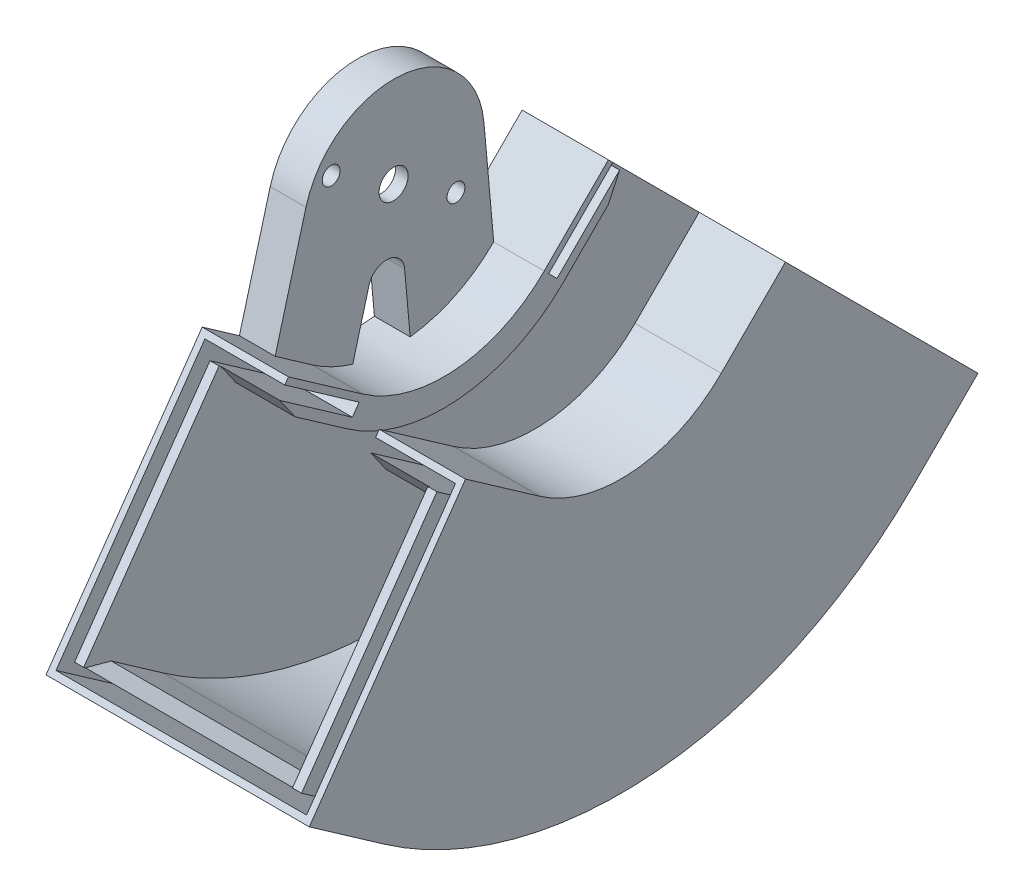
from build123d import *

# Parameters (mm, degrees)
BOSS_EXTRUDE2_DEPTH   = 58.42
BOSS_EXTRUDE2_2_DEPTH = 58.42
BOSS_EXTRUDE3_DEPTH   = 7.62
SKETCH6_W             = 73.66
SKETCH6_H             = 76.2
SKETCH6_W_2           = 70.104
SKETCH6_H_2           = 72.644
SKETCH6_W_3           = 63.5
SKETCH6_H_3           = 66.04
SKETCH6_W_4           = 58.42
SKETCH6_H_4           = 60.96
BOSS_EXTRUDE4_DEPTH   = 25.4
SKETCH7_W             = 73.66
SKETCH7_H             = 76.2
SKETCH7_W_2           = 70.104
SKETCH7_H_2           = 72.644
SKETCH7_W_3           = 63.5
SKETCH7_H_3           = 66.04
SKETCH7_W_4           = 58.42
SKETCH7_H_4           = 60.96
BOSS_EXTRUDE5_DEPTH   = 25.4
CHAMFER1_SIZE         = 2.773453185
CHAMFER1_SIZE_2       = 7.62
CUT_EXTRUDE3_REACH    = 158.41
SKETCH10_W            = 25.4
SKETCH10_H            = 177.72143494
SKETCH11_R            = 4.064
SKETCH11_R_2          = 2.5
BOSS_EXTRUDE6_DEPTH   = 10
SKETCH12_R            = 17
CUT_EXTRUDE4_DEPTH    = 6.5


with BuildPart() as part:
    # Sketch3 → Boss-Extrude2 (new body)
    with BuildSketch(Plane(origin=(0, 0, 0), x_dir=(0, 0, -1), z_dir=(1, 0, 0))):
        with BuildLine():
            Line((-62.063264719, -88.6355278), (-66.433917164, -94.877466378))
            ThreePointArc((-66.433917164, -94.877466378), (10.094726748, -115.383254712), (81.899935824, -81.899935824))
            Line((81.899935824, -81.899935824), (76.511782152, -76.511782152))
            ThreePointArc((76.511782152, -76.511782152), (9.430599988, -107.792251112), (-62.063264719, -88.6355278))
        make_face()
    extrude(amount=BOSS_EXTRUDE2_DEPTH)



with BuildPart() as body_2:
    # Sketch3 → Boss-Extrude2 2 (new body)
    with BuildSketch(Plane(origin=(0, 0, 0), x_dir=(0, 0, -1), z_dir=(1, 0, 0))):
        with BuildLine():
            ThreePointArc((28.018399098, -28.018399098), (3.453459151, -39.473218717), (-22.727392714, -32.458080603))
            Line((-22.727392714, -32.458080603), (-27.098045159, -38.70001918))
            ThreePointArc((-27.098045159, -38.70001918), (4.11758591, -47.064222317), (33.40655277, -33.40655277))
            Line((33.40655277, -33.40655277), (28.018399098, -28.018399098))
        make_face()
    extrude(amount=BOSS_EXTRUDE2_2_DEPTH)


with BuildPart() as part_1:
    add(part.part)

    add(body_2.part)  # Boss-Extrude3 merges body 2
    # Sketch4 → Boss-Extrude3 (add)
    with BuildSketch(Plane(origin=(58.42, 0, 0), x_dir=(0, 0, -1), z_dir=(1, 0, 0))):
        with BuildLine():
            Line((-22.727392714, -32.458080603), (-66.433917164, -94.877466378))
            ThreePointArc((-66.433917164, -94.877466378), (10.094726748, -115.383254712), (81.899935824, -81.899935824))
            Line((81.899935824, -81.899935824), (28.018399098, -28.018399098))
            ThreePointArc((28.018399098, -28.018399098), (3.453459151, -39.473218717), (-22.727392714, -32.458080603))
        make_face()
    boss_extrude3 = extrude(amount=BOSS_EXTRUDE3_DEPTH)

    # Mirror1: Boss-Extrude3 across plane
    add(boss_extrude3.mirror(Plane.ZY.offset(-29.21)))

    # Sketch6 → Boss-Extrude4 (add)
    # profile 1 of 2: a face of its own
    with BuildSketch(Plane(origin=(0, 0, 0), x_dir=(1, 0, 0), z_dir=(0, 0.5735764363510462, 0.8191520442889917))):
        with Locations((29.21, -77.724)):
            Rectangle(SKETCH6_W, SKETCH6_H)
        with Locations((29.21, -77.724)):
            Rectangle(SKETCH6_W_2, SKETCH6_H_2, mode=Mode.SUBTRACT)
    # profile 2 of 2: a face of its own
    with BuildSketch(Plane(origin=(0, 0, 0), x_dir=(1, 0, 0), z_dir=(0, 0.5735764363510462, 0.8191520442889917))):
        with Locations((29.21, -77.724)):
            Rectangle(SKETCH6_W_3, SKETCH6_H_3)
        with Locations((29.21, -77.724)):
            Rectangle(SKETCH6_W_4, SKETCH6_H_4, mode=Mode.SUBTRACT)
    extrude(amount=BOSS_EXTRUDE4_DEPTH)

    # Sketch7 → Boss-Extrude5 (add)
    # profile 1 of 2: a face of its own
    with BuildSketch(Plane(origin=(0, 0, 0), x_dir=(1, 0, 0), z_dir=(0, 0.7071067811865503, -0.7071067811865447))):
        with Locations((29.21, 77.724)):
            Rectangle(SKETCH7_W, SKETCH7_H)
        with Locations((29.21, 77.724)):
            Rectangle(SKETCH7_W_2, SKETCH7_H_2, mode=Mode.SUBTRACT)
    # profile 2 of 2: a face of its own
    with BuildSketch(Plane(origin=(0, 0, 0), x_dir=(1, 0, 0), z_dir=(0, 0.7071067811865503, -0.7071067811865447))):
        with Locations((29.21, 77.724)):
            Rectangle(SKETCH7_W_3, SKETCH7_H_3)
        with Locations((29.21, 77.724)):
            Rectangle(SKETCH7_W_4, SKETCH7_H_4, mode=Mode.SUBTRACT)
    extrude(amount=BOSS_EXTRUDE5_DEPTH)

    # Chamfer1
    # the kernel refuses this chamfer: 7.62, 2.773453185 mm, written as the material it takes off along each edge
    with BuildSketch(Plane(origin=(58.42, -15.446040528, -51.367065013), x_dir=(0, 0.7736626875489875, 0.6335977003544738), z_dir=(-1, 0, 0)), Plane(origin=(0, -24.131177697, 47.904507084), x_dir=(0, 0.8719320989550161, -0.489626811778011), z_dir=(1, 0, 0))) as chamfer1_piece_1:
        Polygon((CHAMFER1_SIZE * 0.995083363221, -CHAMFER1_SIZE * 0.0990409022559), (-CHAMFER1_SIZE_2 * 0.0990409022521, -CHAMFER1_SIZE_2 * 0.995083363182), (0, 0), align=None)
    extrude(amount=58.42, mode=Mode.SUBTRACT)
    with BuildSketch(Plane(origin=(0, -58.551269909, -94.472294394), x_dir=(0, -0.6977227871251116, 0.7163678610367485), z_dir=(1, 0, 0)), Plane(origin=(58.42, -74.066686317, 82.869726644), x_dir=(0, -0.562726836605906, -0.8266429140587307), z_dir=(-1, 0, 0))) as chamfer1_piece_2:
        Polygon((CHAMFER1_SIZE_2 * 0.999913086528, CHAMFER1_SIZE_2 * 0.0131840581986), (-CHAMFER1_SIZE * 0.0131840581992, CHAMFER1_SIZE * 0.999913086567), (0, 0), align=None)
    extrude(amount=58.42, mode=Mode.SUBTRACT)

    # Sketch10 → Cut-Extrude3 (cut, up to next)
    with BuildSketch(Plane(origin=(0, -13.973562988, -1.22252835), x_dir=(-1, 0, 0), z_dir=(0, -0.9961946980917453, -0.08715574274766034)), mode=Mode.PRIVATE) as cut_extrude3_sk1:
        with Locations((-29.21, 6.675062398)):
            Rectangle(SKETCH10_W, SKETCH10_H)
    cut_extrude3_tool1 = extrude(cut_extrude3_sk1.sketch, amount=CUT_EXTRUDE3_REACH, mode=Mode.PRIVATE) & part_1.part
    add(cut_extrude3_tool1.solids().sort_by_distance((29.21, -13.391793, -7.87219))[0], mode=Mode.SUBTRACT)

    # Sketch11 → Boss-Extrude6 (add)
    with BuildSketch(Plane.ZY.offset(7.62)):
        with BuildLine():
            Line((-25.298191602, 2.271893855), (-28.018399098, -28.018399098))
            ThreePointArc((-28.018399098, -28.018399098), (-17.287205304, -35.654086845), (-4.646100514, -39.350668686))
            Line((-4.646100514, -39.350668686), (-3.089724987, -22.01997949))
            ThreePointArc((-3.089724987, -22.01997949), (1.526343902, -17.41376085), (6.873353249, -21.146699798))
            Line((6.873353249, -21.146699798), (11.420958182, -37.942365374))
            ThreePointArc((11.420958182, -37.942365374), (17.292970019, -35.651291196), (22.727392714, -32.458080603))
            Line((22.727392714, -32.458080603), (33.130623676, -25.173659861))
            Line((33.130623676, -25.173659861), (24.517199578, 6.638292315))
            ThreePointArc((24.517199578, 6.638292315), (-2.217847157, 25.302987057), (-25.298191602, 2.271893855))
        make_face()
        Circle(SKETCH11_R, mode=Mode.SUBTRACT)
        with Locations((-17.454015953, -10.75208478)):
            Circle(SKETCH11_R_2, mode=Mode.SUBTRACT)
        with Locations((17.454015953, 10.75208478)):
            Circle(SKETCH11_R_2, mode=Mode.SUBTRACT)
    extrude(amount=-BOSS_EXTRUDE6_DEPTH)

    # Sketch12 → Cut-Extrude4 (cut)
    with BuildSketch(Plane.ZY.offset(7.62)):
        Circle(SKETCH12_R)
    extrude(amount=-CUT_EXTRUDE4_DEPTH, mode=Mode.SUBTRACT)


solid = part_1.part
